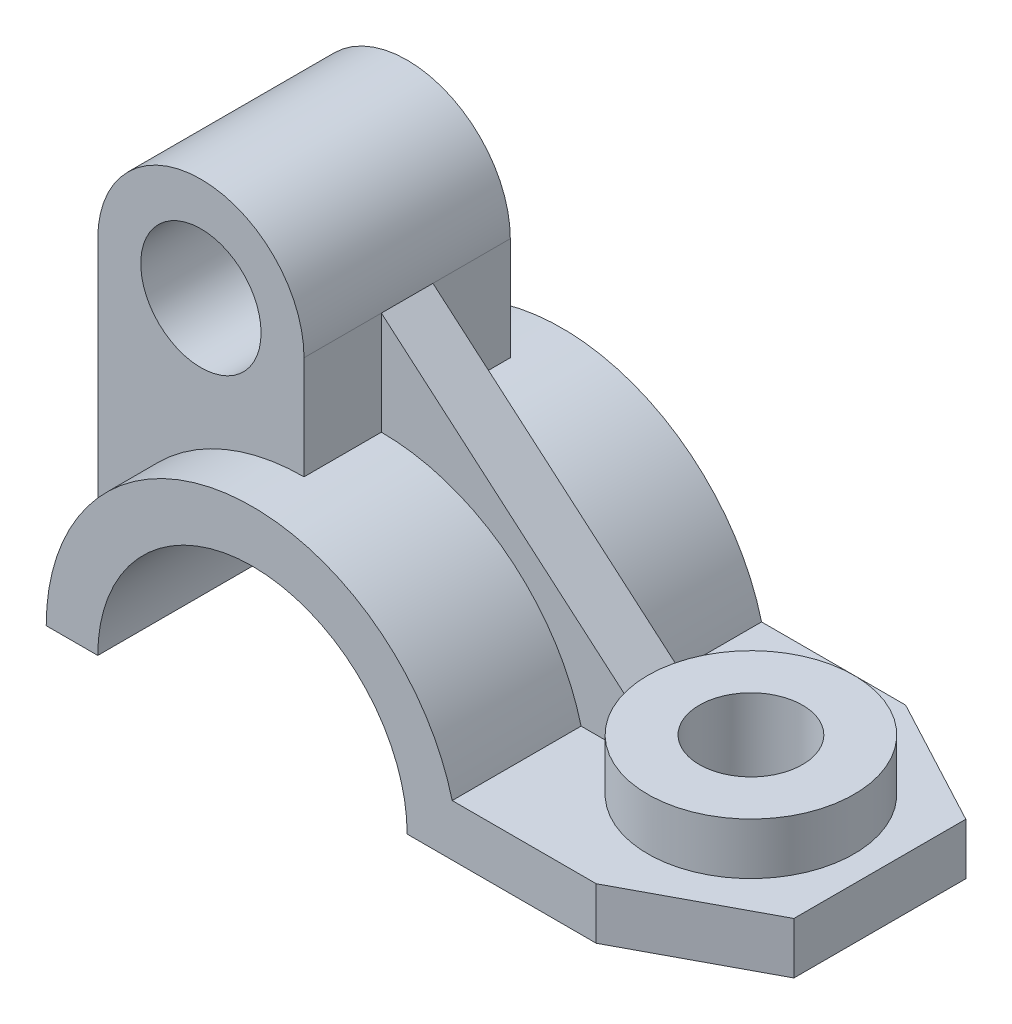
from build123d import *
from build123d.topology import SkipClean

# Parameters (mm, degrees)
BOSS_EXTRUDE1_DEPTH        = 18
SKETCH1_3_R                = 12
SKETCH1_3_R_2              = 7
BOSS_EXTRUDE2_DEPTH        = 12
SKETCH2_R                  = 12
BOSS_EXTRUDE3_DEPTH        = 6
RIB1_REACH                 = 77.186
SKETCH3_WALL_W             = 189.251047722
SKETCH3_WALL_H             = 6
CHAMFER1_SIZE              = 8
CHAMFER1_SIZE2             = 15
CHAMFER2_SIZE              = 15
CHAMFER2_SIZE2             = 8
F_12_0MM_DOWEL_HOLE1_D     = 12
F_12_0MM_DOWEL_HOLE1_DEPTH = 30
F_12_0MM_DOWEL_HOLE1_TIP   = 3.605163714


with BuildPart() as part:
    # Sketch1 → Boss-Extrude1 (new, symmetric)
    with BuildSketch(Plane.XY):
        with BuildLine():
            ThreePointArc((18, 0), (0, 18), (-18, 0))
            Line((-18, 0), (-24, 0))
            ThreePointArc((-24, 0), (-3.02410302, 23.80871271), (23.237900077, 6))
            Line((23.237900077, 6), (55, 6))
            Line((55, 6), (55, 0))
            Line((55, 0), (24, 0))
            Line((24, 0), (18, 0))
        make_face()
    extrude(amount=BOSS_EXTRUDE1_DEPTH, both=True)

    # Sketch1<3> → Boss-Extrude2 (add, symmetric)
    # profile 1 of 2: a face of its own
    with BuildSketch(Plane.XY):
        with BuildLine():
            Line((-24, 36), (-24, 0))
            ThreePointArc((-24, 0), (-16.970562748, 16.970562748), (0, 24))
            Line((0, 24), (0, 36))
            ThreePointArc((0, 36), (-12, 24), (-24, 36))
        make_face()
    # profile 2 of 2: a face of its own
    with BuildSketch(Plane.XY):
        with Locations((-12, 36)):
            Circle(SKETCH1_3_R)
        with Locations((-12, 36)):
            Circle(SKETCH1_3_R_2, mode=Mode.SUBTRACT)
    extrude(amount=BOSS_EXTRUDE2_DEPTH, both=True)

    # Sketch2 → Boss-Extrude3 (add)
    with SkipClean():  # the faces are left unmerged after this step: merging them gives an invalid solid
        with BuildSketch(Plane(origin=(0, 6, 0), x_dir=(1, 0, 0), z_dir=(0, 1, 0))):
            with Locations((40, 0)):
                Circle(SKETCH2_R)
        extrude(amount=BOSS_EXTRUDE3_DEPTH)
    add(part.part.scale(1), mode=Mode.REPLACE)  # the faces are merged on a copy

    # Sketch3 wall → Rib1 (add, up to next)
    with BuildSketch(Plane(origin=(14, 24, 0), x_dir=(0.759256602365, -0.650791373456, 0), z_dir=(0.650791373456, 0.759256602365, 0)), mode=Mode.PRIVATE) as rib1_sk1:
        Rectangle(SKETCH3_WALL_W, SKETCH3_WALL_H)
    rib1_tool1 = extrude(rib1_sk1.sketch, amount=-RIB1_REACH, mode=Mode.PRIVATE) - part.part
    add(rib1_tool1.solids().sort_by_distance((14, 24, 0))[0])

    # Chamfer1
    chamfer1_edges = [part.edges().sort_by_distance(p)[0] for p in [
        (55, 3, 18),
    ]]
    chamfer1_side = [part.faces().sort_by_distance(p)[0] for p in [
        (55, 3, 0),
    ]]
    chamfer(chamfer1_edges, length=CHAMFER1_SIZE, length2=CHAMFER1_SIZE2, reference=chamfer1_side[0])

    # Chamfer2
    chamfer2_edges = [part.edges().sort_by_distance(p)[0] for p in [
        (55, 3, -18),
    ]]
    chamfer2_side = [part.faces().sort_by_distance(p)[0] for p in [
        (39.118950039, 5.174348742, -18),
    ]]
    chamfer(chamfer2_edges, length=CHAMFER2_SIZE, length2=CHAMFER2_SIZE2, reference=chamfer2_side[0])

    # Ø12.0mm Dowel Hole1
    with Locations(Plane(origin=(40, 12, 0), x_dir=(1, 0, 0), z_dir=(0, 1, 0))):
        with Locations((0, 0)):
            Hole(F_12_0MM_DOWEL_HOLE1_D / 2, depth=F_12_0MM_DOWEL_HOLE1_DEPTH)
            with Locations((0, 0, -(F_12_0MM_DOWEL_HOLE1_DEPTH + F_12_0MM_DOWEL_HOLE1_TIP / 2))):  # 118° drill point
                Cone(0, F_12_0MM_DOWEL_HOLE1_D / 2, F_12_0MM_DOWEL_HOLE1_TIP, mode=Mode.SUBTRACT)


solid = part.part
